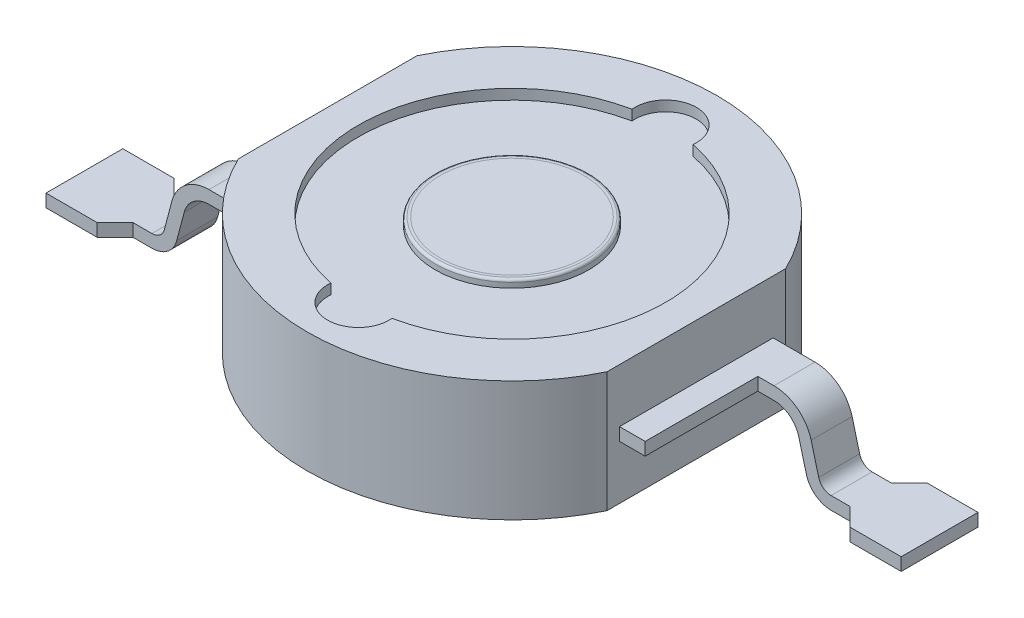
from build123d import *

# Parameters (mm, degrees)
SKETCH1_R           = 4
EXTRUDE1_DEPTH      = 2.6
EXTRUDE2_START      = -4
EXTRUDE2_DEPTH      = 5
CUT_EXTRUDE1_DEPTH  = 0.2
SKETCH12_R          = 1.5
BOSS_EXTRUDE3_DEPTH = 0.15
FILLET4_R           = 0.05
EXTRUDE_THIN1_START = 1.1
EXTRUDE_THIN1_DEPTH = 0.4
EXTRUDE3_DEPTH      = 0.25
SKETCH10_R          = 3
EXTRUDE6_DEPTH      = 0.25
SKETCH13_W          = 0.5
SKETCH13_H          = 2.199959577
BOSS_EXTRUDE4_DEPTH = 0.25
CIRPATTERN1_COUNT   = 2


with BuildPart() as part:
    # Sketch1 → Extrude1 (new body)
    with BuildSketch(Plane(origin=(0, 0, 0), x_dir=(1, 0, 0), z_dir=(0, 1, 0))):
        with Locations(Location((0, 0, 0), (0, 0, 270))):
            Circle(SKETCH1_R)
    extrude(amount=EXTRUDE1_DEPTH)

    # Extrude2: read off the stored shape, not the designer's step
    # Extrude2 outline → Extrude2 (cut)
    with BuildSketch(Plane(origin=(0, 2.6, 0), x_dir=(1, 0, 0), z_dir=(0, 1, 0)).offset(EXTRUDE2_START)):
        with BuildLine():
            Line((-3.6, -1.743559577), (-3.6, 1.743559577))
            ThreePointArc((-3.6, 1.743559577), (-4, 0), (-3.6, -1.743559577))
        make_face()
        with BuildLine():
            ThreePointArc((3.6, -1.743559577), (4, 0), (3.6, 1.743559577))
            Line((3.6, 1.743559577), (3.6, -1.743559577))
        make_face()
    extrude(amount=EXTRUDE2_DEPTH, mode=Mode.SUBTRACT)

    # Sketch2<3> → Cut-Extrude1 (cut)
    with BuildSketch(Plane(origin=(0, 2.6, 0), x_dir=(1, 0, 0), z_dir=(0, 1, 0))):
        with BuildLine():
            ThreePointArc((-0.596992462, -2.94), (0, -3.6), (0.596992462, -2.94))
            ThreePointArc((0.596992462, -2.94), (3, 0), (0.596992462, 2.94))
            ThreePointArc((0.596992462, 2.94), (0, 3.6), (-0.596992462, 2.94))
            ThreePointArc((-0.596992462, 2.94), (-3, 0), (-0.596992462, -2.94))
        make_face()
    extrude(amount=-CUT_EXTRUDE1_DEPTH, mode=Mode.SUBTRACT)

    # Sketch12 → Boss-Extrude3 (add)
    with BuildSketch(Plane(origin=(0, 2.4, 0), x_dir=(1, 0, 0), z_dir=(0, 1, 0))):
        with Locations(Location((0, 0, 0), (0, 0, 270))):
            Circle(SKETCH12_R)
    extrude(amount=BOSS_EXTRUDE3_DEPTH)

    # Fillet4
    fillet4_edges = [part.edges().sort_by_distance(p)[0] for p in [
        (0, 2.55, -1.5),
    ]]
    fillet(fillet4_edges, radius=FILLET4_R)

    # Sketch6 → Extrude-Thin1 (add, symmetric)
    with BuildSketch(Plane.XY.offset(EXTRUDE_THIN1_START)):
        with BuildLine():
            Line((-3.6, 1.3), (-4.416697321, 1.3))
            ThreePointArc((-4.416697321, 1.3), (-4.721601087, 1.19627477), (-4.9, 0.928134773))
            Line((-4.9, 0.928134773), (-5.047479985, 0.371865227))
            ThreePointArc((-5.047479985, 0.371865227), (-5.225878898, 0.10372523), (-5.530782665, 0))
            Line((-5.530782665, 0), (-7.25, 0))
            Line((-7.25, 0), (-7.25, 0.25))
            Line((-7.25, 0.25), (-5.530782665, 0.25))
            ThreePointArc((-5.530782665, 0.25), (-5.378330782, 0.301862615), (-5.289131325, 0.435932613))
            Line((-5.289131325, 0.435932613), (-5.14165134, 0.99220216))
            ThreePointArc((-5.14165134, 0.99220216), (-4.87405297, 1.394412155), (-4.416697321, 1.55))
            Line((-4.416697321, 1.55), (-3.6, 1.55))
            Line((-3.6, 1.55), (-3.6, 1.3))
        make_face()
    extrude_thin1 = extrude(amount=EXTRUDE_THIN1_DEPTH, both=True)

    # Sketch7 → Extrude3 (add)
    with BuildSketch(Plane(origin=(0, 0.25, 0), x_dir=(1, 0, 0), z_dir=(0, 1, 0))):
        Polygon((-5.9, -0.7), (-6.25, -0.35), (-7.25, -0.35), (-7.25, -1.85), (-6.25, -1.85), (-5.9, -1.5), align=None)
    extrude3 = extrude(amount=-EXTRUDE3_DEPTH)

    # Sketch10 → Extrude6 (cut)
    with BuildSketch(Plane.XZ):
        with BuildLine():
            Line((3.6, -1.743559577), (3.6, 1.743559577))
            ThreePointArc((3.6, 1.743559577), (0, 4), (-3.6, 1.743559577))
            Line((-3.6, 1.743559577), (-3.6, -1.743559577))
            ThreePointArc((-3.6, -1.743559577), (0, -4), (3.6, -1.743559577))
        make_face()
        with Locations(Location((0, 0, 0), (0, 0, 270))):
            Circle(SKETCH10_R, mode=Mode.SUBTRACT)
    extrude(amount=-EXTRUDE6_DEPTH, mode=Mode.SUBTRACT)

    # Sketch13 → Boss-Extrude4 (add)
    with BuildSketch(Plane(origin=(0, 1.55, 0), x_dir=(1, 0, 0), z_dir=(0, 1, 0))):
        with Locations((-3.85, 0.399979788)):
            Rectangle(SKETCH13_W, SKETCH13_H)
    boss_extrude4 = extrude(amount=-BOSS_EXTRUDE4_DEPTH)

    # CirPattern1: Extrude-Thin1, Extrude3, Boss-Extrude4 ×2 about axis
    cirpattern1_axis = Axis((0, 0, 0), (0, 1, 0))
    add([extrude_thin1.rotate(cirpattern1_axis, i * 360 / CIRPATTERN1_COUNT) for i in range(1, CIRPATTERN1_COUNT)])
    add([extrude3.rotate(cirpattern1_axis, i * 360 / CIRPATTERN1_COUNT) for i in range(1, CIRPATTERN1_COUNT)])
    add([boss_extrude4.rotate(cirpattern1_axis, i * 360 / CIRPATTERN1_COUNT) for i in range(1, CIRPATTERN1_COUNT)])


solid = part.part
